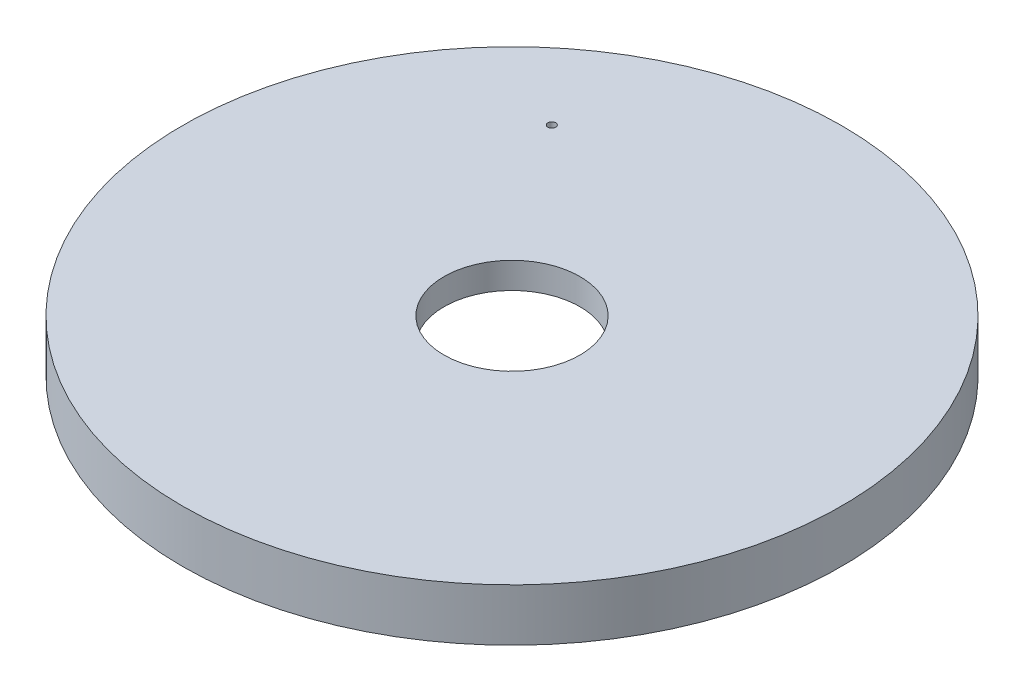
from build123d import *

# Parameters (mm, degrees)
SZKIC2_R                   = 0.75
WYTNIJ_WYCI_GNI_CIE2_DEPTH = 15


with BuildPart() as part:
    # Szkic1 → Obrót1 (revolve)
    with BuildSketch(Plane.XY):
        Polygon((13, 2.5), (63, 2.5), (63, -7.5), (31.660254038, -7.5), (13, -2.5), align=None)
    revolve(axis=Axis((0, 24.608336301, 0), (0, -1, 0)))

    # Szkic2 → Wytnij-wyciągnięcie2 (cut, symmetric)
    with BuildSketch(Plane(origin=(0, 0, 0), x_dir=(1, 0, 0), z_dir=(0, 1, 0))):
        with Locations((-27.785960816, 35.396897909)):
            Circle(SZKIC2_R)
    extrude(amount=WYTNIJ_WYCI_GNI_CIE2_DEPTH, both=True, mode=Mode.SUBTRACT)


solid = part.part
